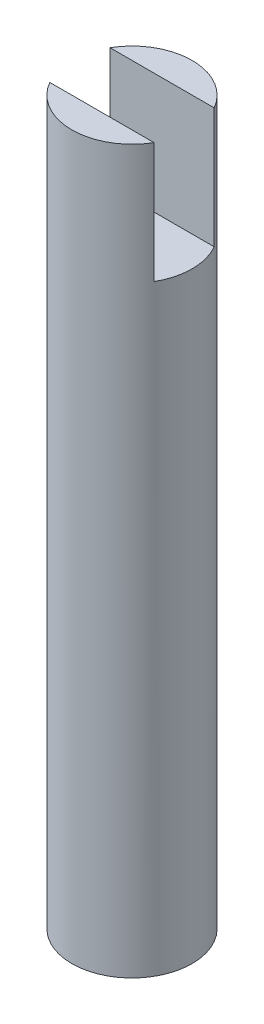
from build123d import *

# Parameters (mm, degrees)
BOSS_EXTRUDE1_DEPTH      = 25.4
BOSS_EXTRUDE1_DEPTH_BACK = 279.4
SKETCH1_R                = 25.4
CUT_EXTRUDE2_DEPTH       = 282.699627263
CUT_EXTRUDE2_DEPTH_BACK  = 282.699627263
SKETCH3_W                = 25.4
SKETCH3_H                = 50.8


with BuildPart() as part:
    # Sketch1 → Boss-Extrude1 (new, two sides: drawn at the far end of the back side and taken through both)
    with BuildSketch(Plane(origin=(0, 0, 0), x_dir=(1, 0, 0), z_dir=(0, 1, 0)).offset(-BOSS_EXTRUDE1_DEPTH_BACK)):
        Circle(SKETCH1_R)
    extrude(amount=BOSS_EXTRUDE1_DEPTH + BOSS_EXTRUDE1_DEPTH_BACK)

    # Sketch3 → Cut-Extrude2 (cut, two sides: drawn at the far end of the back side and taken through both)
    with BuildSketch(Plane(origin=(0, 0, 0), x_dir=(0, 0, -1), z_dir=(1, 0, 0)).offset(-CUT_EXTRUDE2_DEPTH_BACK)):
        Rectangle(SKETCH3_W, SKETCH3_H)
    extrude(amount=CUT_EXTRUDE2_DEPTH + CUT_EXTRUDE2_DEPTH_BACK, mode=Mode.SUBTRACT)


solid = part.part
